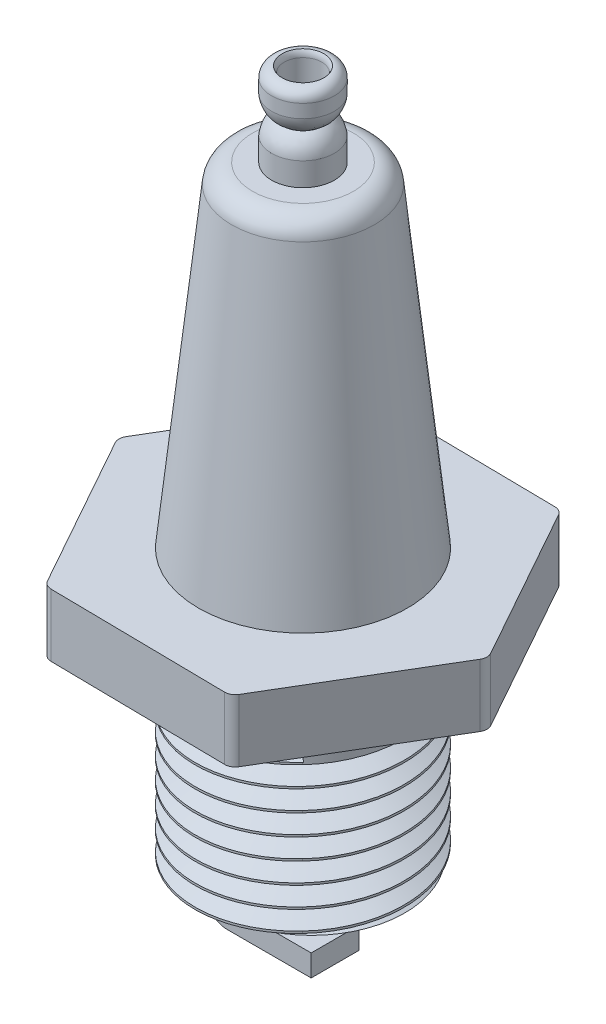
from build123d import *

# Parameters (mm, degrees)
BOSS_EXTRUDE2_DEPTH      = 1.5
SKETCH6_R                = 2.5
BOSS_EXTRUDE3_DEPTH      = 5
SKETCH7_R                = 2.5
BOSS_EXTRUDE4_DEPTH      = 8
BOSS_EXTRUDE4_TAPER      = 6
FILLET1_R                = 0.5
CUT_SWEEP1_PITCH         = 0.5
BOSS_EXTRUDE5_DEPTH      = 2
BOSS_EXTRUDE5_DEPTH_BACK = 15.5
SKETCH10_R               = 0.75
SKETCH11_W               = 0.515830755
SKETCH11_H               = 1.142919996
BOSS_EXTRUDE6_DEPTH      = 1.75
SKETCH12_W               = 1.142919996
SKETCH12_H               = 0.52
BOSS_EXTRUDE7_DEPTH      = 2
FILLET2_R                = 0.5
SKETCH14_R               = 0.45
CUT_EXTRUDE1_DEPTH       = 2
FILLET3_R                = 0.25
FILLET4_R                = 0.25
FILLET5_R                = 0.25


with BuildPart() as part:
    # Sketch5 → Boss-Extrude2 (new body)
    with BuildSketch(Plane(origin=(0, 0, 0), x_dir=(1, 0, 0), z_dir=(0, 1, 0))):
        Polygon((2.197156565, -3.930967188), (4.502895728, -0.062690192), (2.305739163, 3.868276995), (-2.197156565, 3.930967188), (-4.502895728, 0.062690192), (-2.305739163, -3.868276995), align=None)
    extrude(amount=BOSS_EXTRUDE2_DEPTH)

    # Sketch6 → Boss-Extrude3 (add)
    with BuildSketch(Plane.XZ):
        with Locations(Location((0, 0, 0), (0, 0, 270))):
            Circle(SKETCH6_R)
    extrude(amount=BOSS_EXTRUDE3_DEPTH)

    # Sketch7 → Boss-Extrude4 (add)
    with BuildSketch(Plane(origin=(0, 1.5, 0), x_dir=(1, 0, 0), z_dir=(0, 1, 0))):
        with Locations(Location((0, 0, 0), (0, 0, 90))):
            Circle(SKETCH7_R)
    extrude(amount=BOSS_EXTRUDE4_DEPTH, taper=BOSS_EXTRUDE4_TAPER)

    # Fillet1
    fillet1_edges = [part.edges().sort_by_distance(p)[0] for p in [
        (0, 9.5, 1.659166118),
    ]]
    fillet(fillet1_edges, radius=FILLET1_R)

    # Cut-Sweep1: arcs per turn and ends read off the stored shape
    # Cut-Sweep1: the profile of Sketch9 screwed along a right-hand helix through 9 turns, 6 arcs to a turn; built about Z, then put on its axis
    cut_sweep1_z = Axis((0, 0, 0), (0, 0, 1))
    cut_sweep1_corners = [(2.111437583, -0.000959072, -0.469869874), (2.527784729, -0.009179081, -0.211630673), (2.543366134, 0.006402324, -0.701134952)]
    with BuildLine(mode=Mode.PRIVATE) as cut_sweep1_profile:
        Line(cut_sweep1_corners[0], cut_sweep1_corners[1])
        Line(cut_sweep1_corners[1], cut_sweep1_corners[2])
        Line(cut_sweep1_corners[2], cut_sweep1_corners[0])
    cut_sweep1_cap = Face(cut_sweep1_profile.wire())
    cut_sweep1_turn_angles = [0, 30, 60, 90, 120, 150, 180, 210, 240, 270, 300, 330, 360]
    cut_sweep1_turn_weights = [1, 0.8660254037844387, 1, 0.8660254037844387, 1, 0.8660254037844387, 1, 0.8660254037844387, 1, 0.8660254037844387, 1, 0.8660254037844387, 1]
    cut_sweep1_turn_rails = [Edge.make_bspline([Vector(p[0], p[1], 0).rotate(cut_sweep1_z, cut_sweep1_turn_angles[k]) / cut_sweep1_turn_weights[k] + Vector(0, 0, p[2] + CUT_SWEEP1_PITCH * cut_sweep1_turn_angles[k] / 360) for k in range(13)], [0, 0, 0, 1, 1, 2, 2, 3, 3, 4, 4, 5, 5, 6, 6, 6], 2, cut_sweep1_turn_weights) for p in cut_sweep1_corners]
    cut_sweep1_turn_sides = [Face.make_surface_from_curves(cut_sweep1_turn_rails[p[0]], cut_sweep1_turn_rails[p[1]]) for p in [(0, 1), (1, 2), (2, 0)]]
    cut_sweep1 = Plane(origin=(0, -5, 0), x_dir=(0.7071067811865438, 0, 0.7071067811865512), z_dir=(0, 1, 0)) * Solid(Shell([*[p.moved(Location((0, 0, CUT_SWEEP1_PITCH * i))) for i in range(9) for p in cut_sweep1_turn_sides], cut_sweep1_cap, cut_sweep1_cap.rotate(cut_sweep1_z, 3240).moved(Location((0, 0, CUT_SWEEP1_PITCH * 3240 / 360)))]))
    add(cut_sweep1, mode=Mode.SUBTRACT)

    # Sketch11 → Boss-Extrude6 (add)
    with BuildSketch(Plane.XZ.offset(5)):
        with Locations((-1.490933605, 0)):
            Rectangle(SKETCH11_W, SKETCH11_H)
    extrude(amount=BOSS_EXTRUDE6_DEPTH)

    # Sketch12 → Boss-Extrude7 (add)
    with BuildSketch(Plane(origin=(-1.233018227, 0, 0), x_dir=(0, 0, -1), z_dir=(1, 0, 0))):
        with Locations((0, -6.49)):
            Rectangle(SKETCH12_W, SKETCH12_H)
    extrude(amount=BOSS_EXTRUDE7_DEPTH)

    # Fillet2
    fillet2_edges = [part.edges().sort_by_distance(p)[0] for p in [
        (-1.748848982, -6.75, 0),
        (-1.233018227, -6.23, 0),
    ]]
    fillet(fillet2_edges, radius=FILLET2_R)

    # Fillet5
    fillet5_edges = [part.edges().sort_by_distance(p)[0] for p in [
        (-2.305739163, 0.75, 3.868276995),
        (-4.502895728, 0.75, -0.062690192),
        (-2.197156565, 0.75, -3.930967188),
        (2.305739163, 0.75, -3.868276995),
        (4.502895728, 0.75, 0.062690192),
        (2.197156565, 0.75, 3.930967188),
    ]]
    fillet(fillet5_edges, radius=FILLET5_R)


with BuildPart() as body_2:
    # Sketch10 → Boss-Extrude5 (new, two sides: drawn at the far end of the back side and taken through both)
    with BuildSketch(Plane(origin=(0, 9.5, 0), x_dir=(1, 0, 0), z_dir=(0, 1, 0)).offset(-BOSS_EXTRUDE5_DEPTH_BACK)):
        with Locations(Location((0, 0, 0), (0, 0, 270))):
            Circle(SKETCH10_R)
    extrude(amount=BOSS_EXTRUDE5_DEPTH + BOSS_EXTRUDE5_DEPTH_BACK)

    # Sketch14 → Cut-Extrude1 (cut)
    with BuildSketch(Plane(origin=(0, 11.5, 0), x_dir=(1, 0, 0), z_dir=(0, 1, 0))):
        with Locations(Location((0, 0, 0), (0, 0, 270))):
            Circle(SKETCH14_R)
    extrude(amount=-CUT_EXTRUDE1_DEPTH, mode=Mode.SUBTRACT)

    # Fillet3
    fillet3_edges = [body_2.edges().sort_by_distance(p)[0] for p in [
        (0, 11.5, -0.75),
    ]]
    fillet(fillet3_edges, radius=FILLET3_R)

    # Fillet4
    # the kernel refuses this fillet: 0.25 mm, written as the material it takes off along each edge
    with BuildSketch(Plane(origin=(0, 11.5, 0), x_dir=(0, 0, 1), z_dir=(-1, 0, 0))) as fillet4_piece_1:
        with BuildLine():
            CenterArc((0.7, -0.15), FILLET4_R, 143.130102354, 36.869897646)
            Line((0.45, -0.15), (0.445, -0.15))
            Line((0.445, -0.15), (0.445, 0))
            Line((0.445, 0), (0.45, 0.005))
            ThreePointArc((0.45, 0.005), (0.475, 0.005), (0.496, 0.003))
            Line((0.496, 0.003), (0.5, 0))
        make_face()
    revolve(axis=Axis((0, 11.5, 0), (0, 1, 0)), mode=Mode.SUBTRACT)

    # Sketch15 → Cut-Revolve1 (revolve, cut)
    with BuildSketch(Plane.XY, mode=Mode.PRIVATE) as cut_revolve1_sk:
        with BuildLine():
            Line((-0.75, 10.058412896), (-0.75, 10.930517914))
            add(Edge.make_bspline(
                [(-0.75, 10.930517914), (-0.719249333, 10.644082593), (-0.48798174, 10.494465405)],
                knots=[0, 0, 0, 1, 1, 1], degree=2))
            add(Edge.make_bspline(
                [(-0.75, 10.058412896), (-0.719249333, 10.344848216), (-0.48798174, 10.494465405)],
                knots=[0, 0, 0, 1, 1, 1], degree=2))
        make_face()
    revolve(cut_revolve1_sk.sketch.rotate(Axis((0, 9.50172902, 0), (0, 1, 0)), 134.802209344), axis=Axis((0, 9.50172902, 0), (0, 1, 0)), mode=Mode.SUBTRACT)


solid = Compound([part.part, body_2.part])
